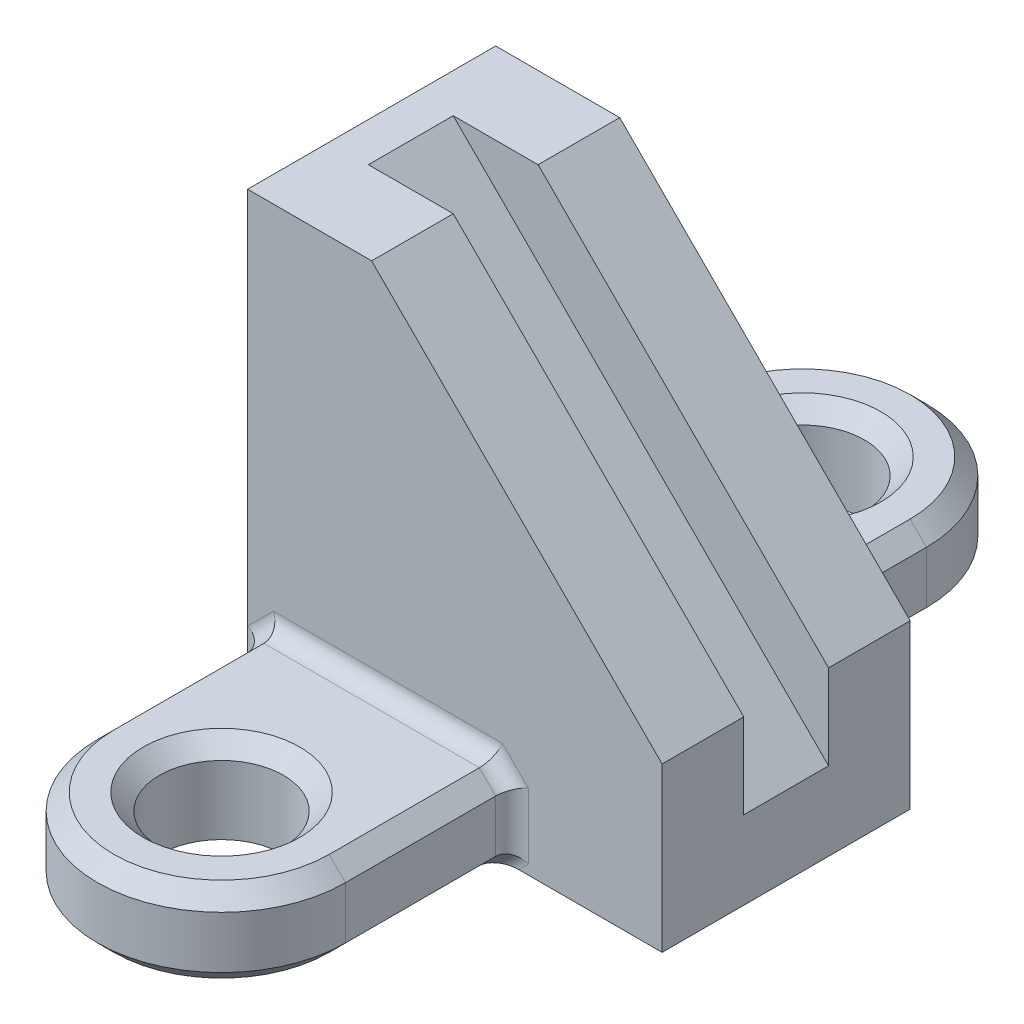
from build123d import *

# Parameters (mm, degrees)
BOSS_EXTRUDE1_DEPTH      = 38
SKETCH2_W                = 26
SKETCH2_H                = 26
CUT_EXTRUDE1_DEPTH       = 178
BOSS_EXTRUDE2_DEPTH      = 26
CHAMFER2_SIZE            = 5
FILLET4_R                = 5
SKETCH4_R                = 19
CUT_EXTRUDE2_DEPTH       = 26
CHAMFER3_SIZE            = 5
CHAMFER3_OF_MIRROR1_SIZE = 5
CHAMFER4_SIZE            = 5
FILLET5_R                = 5


with BuildPart() as part:
    # Sketch1 → Boss-Extrude1 (new, symmetric)
    with BuildSketch(Plane.XY):
        Polygon((0, 139), (0, 0), (127, 0), (127, 50), (38, 139), align=None)
    extrude(amount=BOSS_EXTRUDE1_DEPTH, both=True)

    # Sketch2 → Cut-Extrude1 (cut, along a direction that is not the sketch's normal)
    with BuildSketch(Plane(origin=(0, 139, 0), x_dir=(1, 0, 0), z_dir=(0, 1, 0))):
        with Locations((25, 0)):
            Rectangle(SKETCH2_W, SKETCH2_H)
    extrude(amount=-CUT_EXTRUDE1_DEPTH, dir=(-0.7071067811865489, 0.7071067811865462, 0), mode=Mode.SUBTRACT)

    # Sketch3 → Boss-Extrude2 (add)
    with BuildSketch(Plane.XZ):
        with BuildLine():
            Line((5, 38), (5, 89))
            ThreePointArc((5, 89), (43, 127), (81, 89))
            Line((81, 89), (81, 38))
            Line((81, 38), (5, 38))
        make_face()
    boss_extrude2 = extrude(amount=-BOSS_EXTRUDE2_DEPTH)

    # Chamfer2
    chamfer2_edges = [part.edges().sort_by_distance(p)[0] for p in [
        (5, 26, 63.5),
        (43, 26, 127),
        (81, 26, 63.5),
        (81, 0, 63.5),
        (43, 0, 127),
        (5, 0, 63.5),
    ]]
    chamfer(chamfer2_edges, length=CHAMFER2_SIZE)

    # Fillet4
    fillet4_edges = [part.edges().sort_by_distance(p)[0] for p in [
        (5, 13, 38),
        (81, 13, 38),
        (43, 26, 38),
        (7.5, 2.5, 38),
        (78.5, 2.5, 38),
        (7.5, 23.5, 38),
        (78.5, 23.5, 38),
    ]]
    fillet(fillet4_edges, radius=FILLET4_R - 0.0001)  # a hair under: the kernel refuses the full size

    # Sketch4 → Cut-Extrude2 (cut)
    with BuildSketch(Plane(origin=(0, 26, 0), x_dir=(1, 0, 0), z_dir=(0, 1, 0))):
        with Locations(Location((43, -89, 0), (0, 0, 270))):
            Circle(SKETCH4_R)
    cut_extrude2 = extrude(amount=-CUT_EXTRUDE2_DEPTH, mode=Mode.SUBTRACT)

    # Chamfer3
    chamfer3_edges = [part.edges().sort_by_distance(p)[0] for p in [
        (43, 26, 70),
    ]]
    chamfer(chamfer3_edges, length=CHAMFER3_SIZE)

    # Mirror1: Boss-Extrude2, Cut-Extrude2 across plane
    add(boss_extrude2.mirror(Plane.XY))
    add(cut_extrude2.mirror(Plane.XY), mode=Mode.SUBTRACT)

    # Chamfer3 of Mirror1
    chamfer3_of_mirror1_edges = [part.edges().sort_by_distance(p)[0] for p in [
        (43, 26, -70),
    ]]
    chamfer(chamfer3_of_mirror1_edges, length=CHAMFER3_OF_MIRROR1_SIZE)

    # Chamfer4
    chamfer4_edges = [part.edges().sort_by_distance(p)[0] for p in [
        (81, 0, -63.5),
        (43, 0, -127),
        (5, 0, -63.5),
        (81, 26, -63.5),
        (43, 26, -127),
        (5, 26, -63.5),
    ]]
    chamfer(chamfer4_edges, length=CHAMFER4_SIZE)

    # Fillet5
    fillet5_edges = [part.edges().sort_by_distance(p)[0] for p in [
        (5, 13, -38),
        (81, 13, -38),
        (43, 26, -38),
        (7.5, 2.5, -38),
        (78.5, 2.5, -38),
        (7.5, 23.5, -38),
        (78.5, 23.5, -38),
    ]]
    fillet(fillet5_edges, radius=FILLET5_R - 0.0001)  # a hair under: the kernel refuses the full size


solid = part.part
